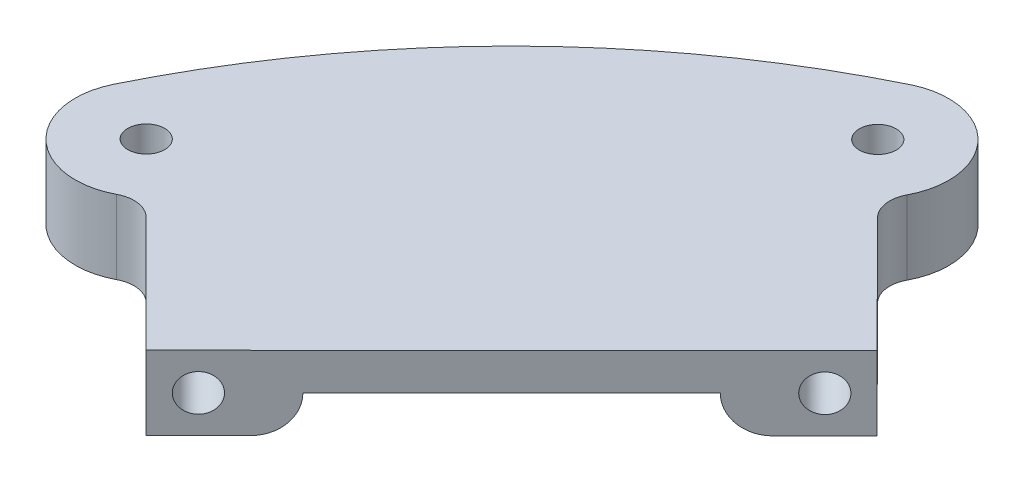
from build123d import *

# Parameters (mm, degrees)
SKETCH10_R                   = 3.175
BOSS_EXTRUDE1_DEPTH          = 12.7
SKETCH13_R                   = 3.175
TAPPED_HOLE_FOR_LID_DEPTH    = 12.7
CUT_TO_DECREASE_MASS_DEPTH   = 50.8
EIGTH_INCH_INTERNAL_FILLET_R = 3.175


with BuildPart() as part:
    # Sketch10 → Boss-Extrude1 (new body)
    with BuildSketch(Plane(origin=(0, 0, 0), x_dir=(1, 0, 0), z_dir=(0, 1, 0))):
        with BuildLine():
            Line((-7.543952838, -5.974068145), (-70.419757016, -68.718954232))
            Line((-70.419757016, -68.718954232), (-90.175514458, -48.954289951))
            ThreePointArc((-90.175514458, -48.954289951), (-93.011705319, -47.522259817), (-96.143902741, -48.0552028))
            ThreePointArc((-96.143902741, -48.0552028), (-110.274094487, -46.08424648), (-112.854196125, -32.052494517))
            ThreePointArc((-112.854196125, -32.052494517), (-100.207656711, -10.837422412), (-84.235041656, 8.001096953))
            ThreePointArc((-84.235041656, 8.001096953), (-65.363270894, 23.934411483), (-44.121885218, 36.536704058))
            ThreePointArc((-44.121885218, 36.536704058), (-30.095541538, 33.92736112), (-28.154041586, 19.79309193))
            ThreePointArc((-28.154041586, 19.79309193), (-28.693511967, 16.662012146), (-27.267396522, 13.822842611))
            Line((-27.267396522, 13.822842611), (-7.543952838, -5.974068145))
        make_face()
        with Locations(Location((-101.843613637, -37.280998562, 0), (0, 0, 270))):
            Circle(SKETCH10_R, mode=Mode.SUBTRACT)
        with Locations(Location((-38.9163423, 25.515247521, 0), (0, 0, 90))):
            Circle(SKETCH10_R, mode=Mode.SUBTRACT)
    extrude(amount=BOSS_EXTRUDE1_DEPTH)

    # Sketch13 → Tapped Hole for Lid (cut)
    with BuildSketch(Plane(origin=(-0.777086764, 0, -0.778708166), x_dir=(0.7078433221233256, 0, -0.7063694722490589), z_dir=(0.7063694722490589, 0, 0.7078433221233256))):
        with BuildLine():
            ThreePointArc((-88.862126184, 6.35), (-90.822106286, 9.283317516), (-94.282190214, 8.59506403))
            Line((-94.282190214, 8.59506403), (-89.792062153, 4.10493597))
            ThreePointArc((-89.792062153, 4.10493597), (-89.103808668, 5.134980102), (-88.862126184, 6.35))
        make_face()
        with BuildLine():
            Line((-89.792062153, 4.10493597), (-94.282190214, 8.59506403))
            ThreePointArc((-94.282190214, 8.59506403), (-94.282190214, 4.10493597), (-89.792062153, 4.10493597))
        make_face()
        with Locations(Location((-15.909836001, 6.35, 0), (0, 0, 180))):
            Circle(SKETCH13_R)
    extrude(amount=-TAPPED_HOLE_FOR_LID_DEPTH, mode=Mode.SUBTRACT)

    # Sketch14 → Cut to Decrease Mass (cut)
    with BuildSketch(Plane(origin=(-0.777086764, 0, -0.778708166), x_dir=(0.7078433221233256, 0, -0.7063694722490589), z_dir=(0.7063694722490589, 0, 0.7078433221233256))):
        with BuildLine():
            ThreePointArc((-79.337126184, 6.35), (-81.196998123, 1.859871939), (-85.687126184, 0))
            Line((-85.687126184, 0), (-22.259836001, 0))
            ThreePointArc((-22.259836001, 0), (-26.749964062, 1.859871939), (-28.609836001, 6.35))
            Line((-28.609836001, 6.35), (-79.337126184, 6.35))
        make_face()
    extrude(amount=-CUT_TO_DECREASE_MASS_DEPTH, mode=Mode.SUBTRACT)

    # Eigth Inch Internal Fillet
    # the kernel refuses this fillet: 3.175 mm, written as the material it adds along each edge
    with BuildSketch(Plane(origin=(-52.417132219, 6.35, -21.013480322), x_dir=(0.6718444169056685, -0.3148458040869803, -0.670445522858871), z_dir=(0.22286149992151785, 0.9491428341660821, -0.22239746447275088))) as eigth_inch_internal_fillet_piece_1_section:
        with BuildLine():
            CenterArc((6.35 + EIGTH_INCH_INTERNAL_FILLET_R, -EIGTH_INCH_INTERNAL_FILLET_R), EIGTH_INCH_INTERNAL_FILLET_R, 90, 90)
            Line((6.35 + EIGTH_INCH_INTERNAL_FILLET_R, 0), (6.35, 0))
            Line((6.35, 0), (6.35, -EIGTH_INCH_INTERNAL_FILLET_R))
        make_face()
    eigth_inch_internal_fillet_piece_1 = revolve(axis=Axis((-52.417132219, 6.35, -21.013480322), (-0.7063694722490589, 0, -0.7078433221233256)), revolution_arc=161.648494619, mode=Mode.PRIVATE)
    eigth_inch_internal_fillet_piece_1 = split(eigth_inch_internal_fillet_piece_1, bisect_by=Plane(origin=(-55.789501587, 0, -16.604615259), z_dir=(0, 1, 0)), keep=Keep.TOP, mode=Mode.PRIVATE)
    add(eigth_inch_internal_fillet_piece_1)
    with BuildSketch(Plane(origin=(-97.313716015, 6.35, 23.789621171), x_dir=(0.7078433221233247, 0, -0.7063694722490598), z_dir=(0, 1, 0))) as eigth_inch_internal_fillet_piece_2_section:
        with BuildLine():
            CenterArc((6.35 + EIGTH_INCH_INTERNAL_FILLET_R, -EIGTH_INCH_INTERNAL_FILLET_R), EIGTH_INCH_INTERNAL_FILLET_R, 90, 90)
            Line((6.35 + EIGTH_INCH_INTERNAL_FILLET_R, 0), (6.35, 0))
            Line((6.35, 0), (6.35, -EIGTH_INCH_INTERNAL_FILLET_R))
        make_face()
    eigth_inch_internal_fillet_piece_2 = revolve(axis=Axis((-97.313716015, 6.35, 23.789621171), (-0.7063694722490589, 0, -0.7078433221233256)), revolution_arc=161.648494619, mode=Mode.PRIVATE)
    eigth_inch_internal_fillet_piece_2 = split(eigth_inch_internal_fillet_piece_2, bisect_by=Plane(origin=(-92.897831362, 0, 20.426448518), z_dir=(0, 1, 0)), keep=Keep.TOP, mode=Mode.PRIVATE)
    add(eigth_inch_internal_fillet_piece_2)
    with BuildSketch(Plane(origin=(-51.293430945, 6.35, -22.134841859), x_dir=(0.7063694722490589, 0, 0.7078433221233255), z_dir=(-0.7078433221233256, 0, 0.7063694722490589))) as eigth_inch_internal_fillet_piece_3:
        with BuildLine():
            CenterArc((EIGTH_INCH_INTERNAL_FILLET_R, -EIGTH_INCH_INTERNAL_FILLET_R), EIGTH_INCH_INTERNAL_FILLET_R, 90, 90)
            Line((0, -EIGTH_INCH_INTERNAL_FILLET_R), (0, 0))
            Line((0, 0), (EIGTH_INCH_INTERNAL_FILLET_R, 0))
        make_face()
    extrude(amount=66.602290182)


solid = part.part
